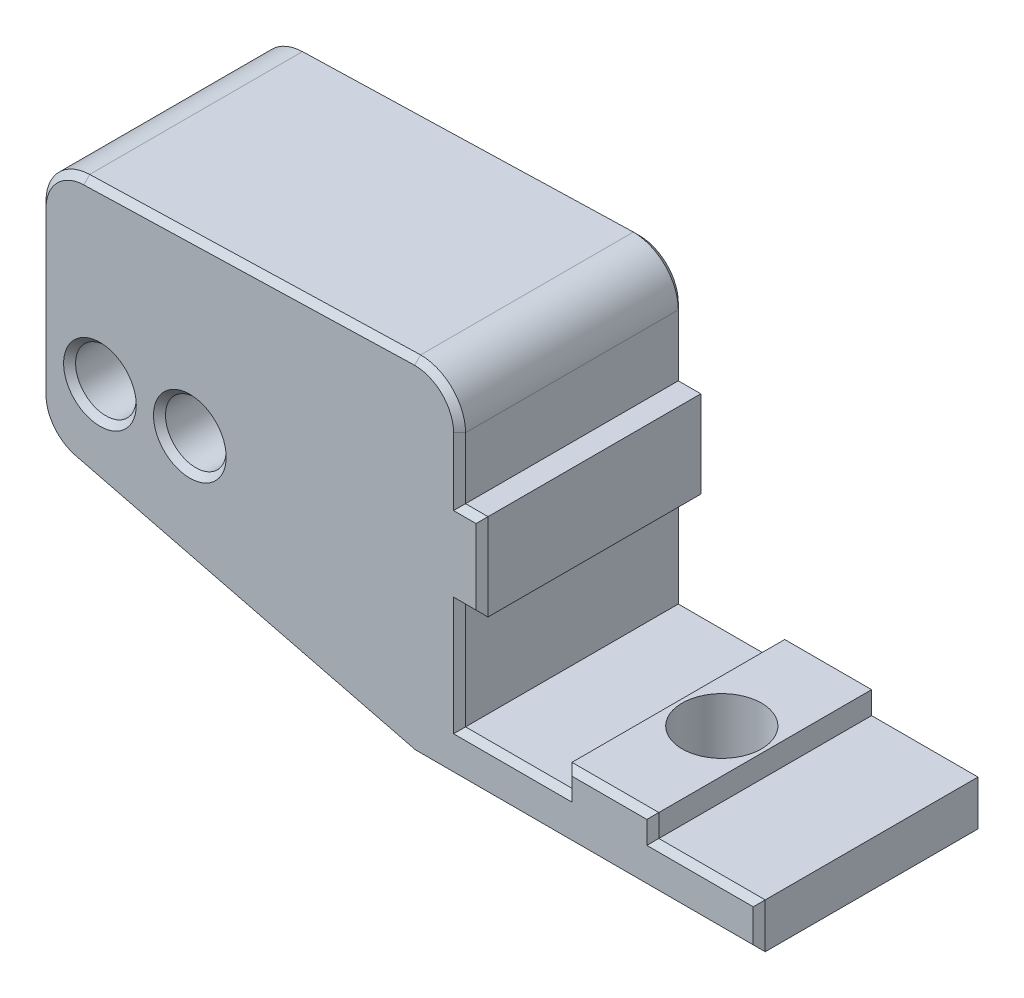
from build123d import *

# Parameters (mm, degrees)
SKETCH1_R           = 3.025
SKETCH1_R_2         = 2.025
BOSS_EXTRUDE1_DEPTH = 15
BOSS_EXTRUDE2_START = 6
SKETCH1_2_R         = 3.025
BOSS_EXTRUDE2_DEPTH = 9
SKETCH2_R           = 2.65
CUT_EXTRUDE1_DEPTH  = 70
FILLET1_R           = 3
CHAMFER1_SIZE       = 0.4


# Some blends are built 0.0001 mm under size
with BuildPart() as part:
    # Sketch1 → Boss-Extrude1 (new body)
    with BuildSketch(Plane.XY):
        Polygon((66.489922843, -72.31585339), (69.489922843, -72.31585339), (69.489922843, -79.41585339), (70.989922843, -79.41585339), (70.989922843, -85.21585339), (69.489922843, -85.21585339), (69.489922843, -92.31585339), (76.589922843, -92.31585339), (76.589922843, -90.81585339), (82.389922843, -90.81585339), (82.389922843, -92.31585339), (89.489922843, -92.31585339), (89.489922843, -95.31585339), (66.489922843, -95.31585339), (41.489922843, -89.06585339), (41.489922843, -73.010297834), align=None)
        with Locations((48.489922843, -77.31585339)):
            Circle(SKETCH1_R, mode=Mode.SUBTRACT)
        with Locations((45.489922843, -84.31585339)):
            Circle(SKETCH1_R_2, mode=Mode.SUBTRACT)
        with Locations((51.489922843, -84.31585339)):
            Circle(SKETCH1_R_2, mode=Mode.SUBTRACT)
    extrude(amount=BOSS_EXTRUDE1_DEPTH)

    # Sketch1<2> → Boss-Extrude2 (add)
    with BuildSketch(Plane.XY.offset(BOSS_EXTRUDE2_START)):
        with Locations((48.489922843, -77.31585339)):
            Circle(SKETCH1_2_R)
    extrude(amount=BOSS_EXTRUDE2_DEPTH)

    # Sketch2 → Cut-Extrude1 (cut)
    with BuildSketch(Plane.XZ.offset(95.31585339)):
        with Locations(Location((79.489922843, 7.5, 0), (0, 0, 270))):
            Circle(SKETCH2_R)
    extrude(amount=-CUT_EXTRUDE1_DEPTH, mode=Mode.SUBTRACT)

    # Fillet1
    fillet1_edges = [part.edges().sort_by_distance(p)[0] for p in [
        (69.489922843, -72.31585339, 7.5),
        (41.489922843, -73.010297834, 7.5),
        (41.489922843, -89.06585339, 7.5),
    ]]
    fillet(fillet1_edges, radius=FILLET1_R - 0.0001)  # a hair under: the kernel refuses the full size

    # Chamfer1
    # the kernel refuses this chamfer: 0.4 mm, written as the material it takes off along each edge
    with BuildSketch(Plane(origin=(69.489922843, -75.31575339, 0), x_dir=(-0.9996219169112966, 2.140826135148345e-13, -0.027495876610585536), z_dir=(0, -1, 0))) as chamfer1_piece_1:
        Polygon((CHAMFER1_SIZE * 0.999621916911, -CHAMFER1_SIZE * 0.0274958766106), (-CHAMFER1_SIZE * 0.0274958766106, -CHAMFER1_SIZE * 0.999621916911), (0, 0), align=None)
    extrude(amount=4.1001, mode=Mode.SUBTRACT)
    with BuildSketch(Plane(origin=(69.489922843, -79.41585339, 0), x_dir=(0, -0.9996219169112966, -0.027495876610585536), z_dir=(1, 0, 0)), Plane(origin=(72.018596038, -85.21585339, 0), x_dir=(0, 0.9996219169112966, -0.027495876610585536), z_dir=(-1, 0, 0)), Plane(origin=(76.589922843, -92.31585339, 0), x_dir=(0.9996219169112966, 0, -0.027495876610585536), z_dir=(0, 1, 0)), Plane(origin=(82.389922843, -89.787180195, 0), x_dir=(-0.9996219169112966, 0, -0.027495876610585536), z_dir=(0, -1, 0))) as chamfer1_piece_2:
        Polygon((CHAMFER1_SIZE * 0.999621916911, -CHAMFER1_SIZE * 0.0274958766106), (-CHAMFER1_SIZE * 0.0274958766106, -CHAMFER1_SIZE * 0.999621916911), (0, 0), align=None)
    extrude(amount=2.528673195, mode=Mode.SUBTRACT)
    with BuildSketch(Plane(origin=(90.518596038, -95.31585339, 15), x_dir=(0, 0.9996219169112966, 0.02749587661058671), z_dir=(-1, 0, 0))) as chamfer1_piece_3:
        Polygon((CHAMFER1_SIZE * 0.999621916911, CHAMFER1_SIZE * 0.0274958766106), (-CHAMFER1_SIZE * 0.0274958766106, CHAMFER1_SIZE * 0.999621916911), (0, 0), align=None)
    extrude(amount=25.05734639, mode=Mode.SUBTRACT)
    with BuildSketch(Plane(origin=(70.989922843, -78.387180195, 0), x_dir=(-0.9996219169112966, -2.6206664757850423e-13, -0.027495876610585536), z_dir=(0, -1, 0)), Plane(origin=(75.561249648, -90.81585339, 0), x_dir=(0, -0.9996219169112966, -0.027495876610585536), z_dir=(1, 0, 0))) as chamfer1_piece_4:
        Polygon((CHAMFER1_SIZE * 0.999621916911, -CHAMFER1_SIZE * 0.0274958766106), (-CHAMFER1_SIZE * 0.0274958766106, -CHAMFER1_SIZE * 0.999621916911), (0, 0), align=None)
    extrude(amount=7.85734639, mode=Mode.SUBTRACT)
    with BuildSketch(Plane(origin=(69.489922843, -85.21585339, 0), x_dir=(-0.9996219169112966, -2.1408261351483406e-13, -0.027495876610585536), z_dir=(0, -1, 0)), Plane(origin=(69.489922843, -92.31585339, 0), x_dir=(0, -0.9996219169112966, -0.027495876610585536), z_dir=(1, 0, 0))) as chamfer1_piece_5:
        Polygon((CHAMFER1_SIZE * 0.999621916911, -CHAMFER1_SIZE * 0.0274958766106), (-CHAMFER1_SIZE * 0.0274958766106, -CHAMFER1_SIZE * 0.999621916911), (0, 0), align=None)
    extrude(amount=7.1, mode=Mode.SUBTRACT)
    with BuildSketch(Plane(origin=(82.389922843, -92.31585339, 0), x_dir=(0, -0.9996219169112966, -0.027495876610585536), z_dir=(1, 0, 0))) as chamfer1_piece_6:
        Polygon((CHAMFER1_SIZE * 0.999621916911, -CHAMFER1_SIZE * 0.0274958766106), (-CHAMFER1_SIZE * 0.0274958766106, -CHAMFER1_SIZE * 0.999621916911), (0, 0), align=None)
    extrude(amount=8.128673195, mode=Mode.SUBTRACT)
    with BuildSketch(Plane(origin=(89.489922843, -91.287180195, 0), x_dir=(-0.9996219169112966, 0, -0.027495876610585536), z_dir=(0, -1, 0))) as chamfer1_piece_7:
        Polygon((CHAMFER1_SIZE * 0.999621916911, -CHAMFER1_SIZE * 0.0274958766106), (-CHAMFER1_SIZE * 0.0274958766106, -CHAMFER1_SIZE * 0.999621916911), (0, 0), align=None)
    extrude(amount=5.05734639, mode=Mode.SUBTRACT)
    with BuildSketch(Plane(origin=(90.518596038, -95.31585339, 0), x_dir=(0, 0.9996219169112966, -0.027495876610585536), z_dir=(-1, 0, 0))) as chamfer1_piece_8:
        Polygon((CHAMFER1_SIZE * 0.999621916911, -CHAMFER1_SIZE * 0.0274958766106), (-CHAMFER1_SIZE * 0.0274958766106, -CHAMFER1_SIZE * 0.999621916911), (0, 0), align=None)
    extrude(amount=25.05734639, mode=Mode.SUBTRACT)
    with BuildSketch(Plane(origin=(89.489922843, -91.287180195, 15), x_dir=(-0.9996219169112966, 0, 0.02749587661058671), z_dir=(0, -1, 0))) as chamfer1_piece_9:
        Polygon((CHAMFER1_SIZE * 0.999621916911, CHAMFER1_SIZE * 0.0274958766106), (-CHAMFER1_SIZE * 0.0274958766106, CHAMFER1_SIZE * 0.999621916911), (0, 0), align=None)
    extrude(amount=5.05734639, mode=Mode.SUBTRACT)
    with BuildSketch(Plane(origin=(44.406524418, -72.929281124, 0), x_dir=(0.02775656898180667, -0.9992364833450456, -0.027495876610586712), z_dir=(0.9996144206527183, 0.027767067240353136, 0)), Plane(origin=(44.406524418, -72.929281124, 15), x_dir=(-0.0007634798546782339, 0.027485274768416574, -0.9996219169112971), z_dir=(0.9996144206527183, 0.027767067240353136, 0))) as chamfer1_piece_10:
        Polygon((CHAMFER1_SIZE * 0.999621916911, -CHAMFER1_SIZE * 0.0274958766106), (-CHAMFER1_SIZE * 0.0274958766106, -CHAMFER1_SIZE * 0.999621916911), (0, 0), align=None)
    extrude(amount=23.120589807, mode=Mode.SUBTRACT)
    with BuildSketch(Plane(origin=(82.389922843, -92.31585339, 15), x_dir=(0, -0.9996219169112966, 0.02749587661058671), z_dir=(1, 0, 0))) as chamfer1_piece_11:
        Polygon((CHAMFER1_SIZE * 0.999621916911, CHAMFER1_SIZE * 0.0274958766106), (-CHAMFER1_SIZE * 0.0274958766106, CHAMFER1_SIZE * 0.999621916911), (0, 0), align=None)
    extrude(amount=8.128673195, mode=Mode.SUBTRACT)
    with BuildSketch(Plane(origin=(82.389922843, -89.787180195, 15), x_dir=(-0.9996219169112966, 0, 0.02749587661058671), z_dir=(0, -1, 0)), Plane(origin=(76.589922843, -92.31585339, 15), x_dir=(0.9996219169112966, 0, 0.02749587661058671), z_dir=(0, 1, 0)), Plane(origin=(72.018596038, -85.21585339, 15), x_dir=(0, 0.9996219169112966, 0.02749587661058671), z_dir=(-1, 0, 0)), Plane(origin=(69.489922843, -79.41585339, 15), x_dir=(0, -0.9996219169112966, 0.02749587661058671), z_dir=(1, 0, 0))) as chamfer1_piece_12:
        Polygon((CHAMFER1_SIZE * 0.999621916911, CHAMFER1_SIZE * 0.0274958766106), (-CHAMFER1_SIZE * 0.0274958766106, CHAMFER1_SIZE * 0.999621916911), (0, 0), align=None)
    extrude(amount=2.528673195, mode=Mode.SUBTRACT)
    with BuildSketch(Plane(origin=(75.561249648, -90.81585339, 15), x_dir=(0, -0.9996219169112966, 0.02749587661058671), z_dir=(1, 0, 0)), Plane(origin=(70.989922843, -78.387180195, 15), x_dir=(-0.9996219169112966, -2.6206664757850423e-13, 0.02749587661058671), z_dir=(0, -1, 0))) as chamfer1_piece_13:
        Polygon((CHAMFER1_SIZE * 0.999621916911, CHAMFER1_SIZE * 0.0274958766106), (-CHAMFER1_SIZE * 0.0274958766106, CHAMFER1_SIZE * 0.999621916911), (0, 0), align=None)
    extrude(amount=7.85734639, mode=Mode.SUBTRACT)
    with BuildSketch(Plane(origin=(48.489922843, -77.31585339, 0), x_dir=(1, 0, 0), z_dir=(0, -1, 0))) as chamfer1_piece_14:
        Polygon((3.025 + CHAMFER1_SIZE, 0), (3.025, CHAMFER1_SIZE), (3.025, 0), align=None)
    revolve(axis=Axis((48.489922843, -77.31585339, 0), (0, 0, 1)), mode=Mode.SUBTRACT)
    with BuildSketch(Plane(origin=(69.489922843, -92.31585339, 15), x_dir=(0, -0.9996219169112966, 0.02749587661058671), z_dir=(1, 0, 0)), Plane(origin=(69.489922843, -85.21585339, 15), x_dir=(-0.9996219169112966, -2.1408261351483406e-13, 0.02749587661058671), z_dir=(0, -1, 0))) as chamfer1_piece_15:
        Polygon((CHAMFER1_SIZE * 0.999621916911, CHAMFER1_SIZE * 0.0274958766106), (-CHAMFER1_SIZE * 0.0274958766106, CHAMFER1_SIZE * 0.999621916911), (0, 0), align=None)
    extrude(amount=7.1, mode=Mode.SUBTRACT)
    with BuildSketch(Plane(origin=(45.489922843, -84.31585339, 0), x_dir=(1, 0, 0), z_dir=(0, -1, 0))) as chamfer1_piece_16:
        Polygon((2.025 + CHAMFER1_SIZE, 0), (2.025, CHAMFER1_SIZE), (2.025, 0), align=None)
    revolve(axis=Axis((45.489922843, -84.31585339, 0), (0, 0, 1)), mode=Mode.SUBTRACT)
    with BuildSketch(Plane(origin=(45.489922843, -84.31585339, 15), x_dir=(1, 0, 0), z_dir=(0, -1, 0))) as chamfer1_piece_17:
        Polygon((2.025 + CHAMFER1_SIZE, 0), (2.025, -CHAMFER1_SIZE), (2.025, 0), align=None)
    revolve(axis=Axis((45.489922843, -84.31585339, 15), (0, 0, 1)), mode=Mode.SUBTRACT)
    with BuildSketch(Plane(origin=(51.489922843, -84.31585339, 0), x_dir=(1, 0, 0), z_dir=(0, -1, 0))) as chamfer1_piece_18:
        Polygon((2.025 + CHAMFER1_SIZE, 0), (2.025, CHAMFER1_SIZE), (2.025, 0), align=None)
    revolve(axis=Axis((51.489922843, -84.31585339, 0), (0, 0, 1)), mode=Mode.SUBTRACT)
    with BuildSketch(Plane(origin=(51.489922843, -84.31585339, 15), x_dir=(1, 0, 0), z_dir=(0, -1, 0))) as chamfer1_piece_19:
        Polygon((2.025 + CHAMFER1_SIZE, 0), (2.025, -CHAMFER1_SIZE), (2.025, 0), align=None)
    revolve(axis=Axis((51.489922843, -84.31585339, 15), (0, 0, 1)), mode=Mode.SUBTRACT)
    with BuildSketch(Plane(origin=(69.489922843, -75.31575339, 15), x_dir=(-0.9996219169112966, 2.140826135148345e-13, 0.02749587661058671), z_dir=(0, -1, 0))) as chamfer1_piece_20:
        Polygon((CHAMFER1_SIZE * 0.999621916911, CHAMFER1_SIZE * 0.0274958766106), (-CHAMFER1_SIZE * 0.0274958766106, CHAMFER1_SIZE * 0.999621916911), (0, 0), align=None)
    extrude(amount=4.1001, mode=Mode.SUBTRACT)
    with BuildSketch(Plane(origin=(67.487882428, -95.565343286, 0), x_dir=(0.2424439264180973, 0.969775705672395, -0.02749587661058577), z_dir=(-0.9701425001453322, 0.2425356250363316, 0))) as chamfer1_piece_21:
        Polygon((CHAMFER1_SIZE * 0.999621916911, -CHAMFER1_SIZE * 0.0274958766106), (-CHAMFER1_SIZE * 0.0274958766106, -CHAMFER1_SIZE * 0.999621916911), (0, 0), align=None)
    extrude(amount=24.455832214, mode=Mode.SUBTRACT)
    with BuildSketch(Plane(origin=(41.489922843, -86.723602248, 0), x_dir=(0.9996219169112968, 0, -0.02749587661058673), z_dir=(0, 1, 0))) as chamfer1_piece_22:
        Polygon((CHAMFER1_SIZE * 0.999621916911, -CHAMFER1_SIZE * 0.0274958766106), (-CHAMFER1_SIZE * 0.0274958766106, -CHAMFER1_SIZE * 0.999621916911), (0, 0), align=None)
    extrude(amount=10.795577824, mode=Mode.SUBTRACT)
    with BuildSketch(Plane(origin=(44.489822843, -86.723602248, 0), x_dir=(-1, 0, 0), z_dir=(0, 1, 0))) as chamfer1_piece_23:
        Polygon((2.9999 - CHAMFER1_SIZE, 0), (2.9999, CHAMFER1_SIZE), (2.9999, 0), align=None)
    revolve(axis=Axis((44.489822843, -86.723602248, 0), (0, 0, 1)), revolution_arc=75.963756532, mode=Mode.SUBTRACT)
    with BuildSketch(Plane(origin=(44.489822843, -75.928024424, 0), x_dir=(-0.02776706724035276, 0.9996144206527183, 0), z_dir=(0.9996144206527183, 0.02776706724035276, 0))) as chamfer1_piece_24:
        Polygon((2.9999 - CHAMFER1_SIZE, 0), (2.9999, CHAMFER1_SIZE), (2.9999, 0), align=None)
    revolve(axis=Axis((44.489822843, -75.928024424, 0), (0, 0, 1)), revolution_arc=88.408859729, mode=Mode.SUBTRACT)
    with BuildSketch(Plane(origin=(66.490022843, -75.31575339, 0), x_dir=(0, 1, 0), z_dir=(-1, 0, 0))) as chamfer1_piece_25:
        Polygon((2.9999 - CHAMFER1_SIZE, 0), (2.9999, -CHAMFER1_SIZE), (2.9999, 0), align=None)
    revolve(axis=Axis((66.490022843, -75.31575339, 0), (0, 0, -1)), revolution_arc=90, mode=Mode.SUBTRACT)
    with BuildSketch(Plane(origin=(41.489922843, -86.723602248, 15), x_dir=(0.9996219169112966, 0, 0.027495876610587656), z_dir=(0, 1, 0))) as chamfer1_piece_26:
        Polygon((CHAMFER1_SIZE * 0.999621916911, CHAMFER1_SIZE * 0.0274958766106), (-CHAMFER1_SIZE * 0.0274958766106, CHAMFER1_SIZE * 0.999621916911), (0, 0), align=None)
    extrude(amount=10.795577824, mode=Mode.SUBTRACT)
    with BuildSketch(Plane(origin=(67.487882428, -95.565343286, 15), x_dir=(0.24244392641809726, 0.9697757056723949, 0.027495876610587038), z_dir=(-0.9701425001453322, 0.2425356250363316, 0))) as chamfer1_piece_27:
        Polygon((CHAMFER1_SIZE * 0.999621916911, CHAMFER1_SIZE * 0.0274958766106), (-CHAMFER1_SIZE * 0.0274958766106, CHAMFER1_SIZE * 0.999621916911), (0, 0), align=None)
    extrude(amount=24.455832214, mode=Mode.SUBTRACT)
    with BuildSketch(Plane(origin=(44.489822843, -86.723602248, 15), x_dir=(-1, 0, 0), z_dir=(0, 1, 0))) as chamfer1_piece_28:
        Polygon((2.9999 - CHAMFER1_SIZE, 0), (2.9999, -CHAMFER1_SIZE), (2.9999, 0), align=None)
    revolve(axis=Axis((44.489822843, -86.723602248, 15), (0, 0, 1)), revolution_arc=75.963756532, mode=Mode.SUBTRACT)
    with BuildSketch(Plane(origin=(44.489822843, -75.928024424, 15), x_dir=(-0.02776706724035276, 0.9996144206527183, 0), z_dir=(0.9996144206527183, 0.02776706724035276, 0))) as chamfer1_piece_29:
        Polygon((2.9999 - CHAMFER1_SIZE, 0), (2.9999, -CHAMFER1_SIZE), (2.9999, 0), align=None)
    revolve(axis=Axis((44.489822843, -75.928024424, 15), (0, 0, 1)), revolution_arc=88.408859729, mode=Mode.SUBTRACT)
    with BuildSketch(Plane(origin=(66.490022843, -75.31575339, 15), x_dir=(0, 1, 0), z_dir=(-1, 0, 0))) as chamfer1_piece_30:
        Polygon((2.9999, CHAMFER1_SIZE), (2.9999 - CHAMFER1_SIZE, 0), (2.9999, 0), align=None)
    revolve(axis=Axis((66.490022843, -75.31575339, 15), (0, 0, -1)), revolution_arc=90, mode=Mode.SUBTRACT)
    with BuildSketch(Plane(origin=(65.461249648, -72.31585339, 15), x_dir=(0, 0.027495876610595927, -0.9996219169112964), z_dir=(1, 0, 0))) as chamfer1_piece_31:
        Polygon((CHAMFER1_SIZE * 0.999621916911, -CHAMFER1_SIZE * 0.0274958766106), (-CHAMFER1_SIZE * 0.0274958766106, -CHAMFER1_SIZE * 0.999621916911), (0, 0), align=None)
    extrude(amount=1.028773195, mode=Mode.SUBTRACT)
    with BuildSketch(Plane(origin=(65.461249648, -72.31585339, 0), x_dir=(0, 0.027495876610595986, 0.9996219169112965), z_dir=(1, 0, 0))) as chamfer1_piece_32:
        Polygon((CHAMFER1_SIZE * 0.999621916911, CHAMFER1_SIZE * 0.0274958766106), (-CHAMFER1_SIZE * 0.0274958766106, CHAMFER1_SIZE * 0.999621916911), (0, 0), align=None)
    extrude(amount=1.028773195, mode=Mode.SUBTRACT)
    with BuildSketch(Plane(origin=(69.489922843, -75.31575339, 0), x_dir=(-0.9996219169112966, 2.140826135148345e-13, -0.027495876610585536), z_dir=(0, -1, 0))) as chamfer1_piece_33a_section:
        Polygon((CHAMFER1_SIZE * 0.999621916911, -CHAMFER1_SIZE * 0.0274958766106), (-CHAMFER1_SIZE * 0.0274958766106, -CHAMFER1_SIZE * 0.999621916911), (0, 0), align=None)
    chamfer1_piece_33a = extrude(amount=5.128773195, mode=Mode.PRIVATE)
    chamfer1_piece_33a = split(chamfer1_piece_33a, bisect_by=Plane(origin=(69.358005392, -79.41585339, 0.131917451), z_dir=(0, -1, 0)), keep=Keep.TOP, mode=Mode.PRIVATE)
    with BuildSketch(Plane(origin=(68.461249648, -79.41585339, 0), x_dir=(0, -0.9996219169112966, -0.027495876610585536), z_dir=(1, 0, 0))) as chamfer1_piece_33b_section:
        Polygon((CHAMFER1_SIZE * 0.999621916911, -CHAMFER1_SIZE * 0.0274958766106), (-CHAMFER1_SIZE * 0.0274958766106, -CHAMFER1_SIZE * 0.999621916911), (0, 0), align=None)
    chamfer1_piece_33b = extrude(amount=3.55734639, mode=Mode.PRIVATE)
    chamfer1_piece_33b = split(chamfer1_piece_33b, bisect_by=Plane(origin=(69.489922843, -79.54777084, 0.131917451), z_dir=(-1, 0, 0)), keep=Keep.TOP, mode=Mode.PRIVATE)
    chamfer1_piece_33 = chamfer1_piece_33a & chamfer1_piece_33b
    add(chamfer1_piece_33, mode=Mode.SUBTRACT)
    with BuildSketch(Plane(origin=(72.018596038, -85.21585339, 0), x_dir=(0, 0.9996219169112966, -0.027495876610585536), z_dir=(-1, 0, 0))) as chamfer1_piece_34a_section:
        Polygon((CHAMFER1_SIZE * 0.999621916911, -CHAMFER1_SIZE * 0.0274958766106), (-CHAMFER1_SIZE * 0.0274958766106, -CHAMFER1_SIZE * 0.999621916911), (0, 0), align=None)
    chamfer1_piece_34a = extrude(amount=3.55734639, mode=Mode.PRIVATE)
    chamfer1_piece_34a = split(chamfer1_piece_34a, bisect_by=Plane(origin=(69.489922843, -85.083935939, 0.131917451), z_dir=(-1, 0, 0)), keep=Keep.TOP, mode=Mode.PRIVATE)
    with BuildSketch(Plane(origin=(69.489922843, -84.187180195, 0), x_dir=(-0.9996219169112966, -2.1408261351483406e-13, -0.027495876610585536), z_dir=(0, -1, 0))) as chamfer1_piece_34b_section:
        Polygon((CHAMFER1_SIZE * 0.999621916911, -CHAMFER1_SIZE * 0.0274958766106), (-CHAMFER1_SIZE * 0.0274958766106, -CHAMFER1_SIZE * 0.999621916911), (0, 0), align=None)
    chamfer1_piece_34b = extrude(amount=8.128673195, mode=Mode.PRIVATE)
    chamfer1_piece_34b = split(chamfer1_piece_34b, bisect_by=Plane(origin=(69.358005392, -85.21585339, 0.131917451), z_dir=(0, 1, 0)), keep=Keep.TOP, mode=Mode.PRIVATE)
    chamfer1_piece_34 = chamfer1_piece_34a & chamfer1_piece_34b
    add(chamfer1_piece_34, mode=Mode.SUBTRACT)
    with BuildSketch(Plane(origin=(69.489922843, -85.21585339, 0), x_dir=(-0.9996219169112966, -2.1408261351483406e-13, -0.027495876610585536), z_dir=(0, -1, 0))) as chamfer1_piece_35a_section:
        Polygon((CHAMFER1_SIZE * 0.999621916911, -CHAMFER1_SIZE * 0.0274958766106), (-CHAMFER1_SIZE * 0.0274958766106, -CHAMFER1_SIZE * 0.999621916911), (0, 0), align=None)
    chamfer1_piece_35a = extrude(amount=8.128673195, mode=Mode.PRIVATE)
    chamfer1_piece_35a = split(chamfer1_piece_35a, bisect_by=Plane(origin=(69.358005392, -92.31585339, 0.131917451), z_dir=(0, -1, 0)), keep=Keep.TOP, mode=Mode.PRIVATE)
    with BuildSketch(Plane(origin=(68.461249648, -92.31585339, 0), x_dir=(0, -0.9996219169112966, -0.027495876610585536), z_dir=(1, 0, 0))) as chamfer1_piece_35b_section:
        Polygon((CHAMFER1_SIZE * 0.999621916911, -CHAMFER1_SIZE * 0.0274958766106), (-CHAMFER1_SIZE * 0.0274958766106, -CHAMFER1_SIZE * 0.999621916911), (0, 0), align=None)
    chamfer1_piece_35b = extrude(amount=8.128673195, mode=Mode.PRIVATE)
    chamfer1_piece_35b = split(chamfer1_piece_35b, bisect_by=Plane(origin=(69.489922843, -92.44777084, 0.131917451), z_dir=(-1, 0, 0)), keep=Keep.TOP, mode=Mode.PRIVATE)
    chamfer1_piece_35 = chamfer1_piece_35a & chamfer1_piece_35b
    add(chamfer1_piece_35, mode=Mode.SUBTRACT)
    with BuildSketch(Plane(origin=(69.489922843, -92.31585339, 0), x_dir=(0, -0.9996219169112966, -0.027495876610585536), z_dir=(1, 0, 0))) as chamfer1_piece_36a_section:
        Polygon((CHAMFER1_SIZE * 0.999621916911, -CHAMFER1_SIZE * 0.0274958766106), (-CHAMFER1_SIZE * 0.0274958766106, -CHAMFER1_SIZE * 0.999621916911), (0, 0), align=None)
    chamfer1_piece_36a = extrude(amount=8.128673195, mode=Mode.PRIVATE)
    chamfer1_piece_36a = split(chamfer1_piece_36a, bisect_by=Plane(origin=(76.589922843, -92.44777084, 0.131917451), z_dir=(1, 0, 0)), keep=Keep.TOP, mode=Mode.PRIVATE)
    with BuildSketch(Plane(origin=(76.589922843, -93.344526585, 0), x_dir=(0.9996219169112966, 0, -0.027495876610585536), z_dir=(0, 1, 0))) as chamfer1_piece_36b_section:
        Polygon((CHAMFER1_SIZE * 0.999621916911, -CHAMFER1_SIZE * 0.0274958766106), (-CHAMFER1_SIZE * 0.0274958766106, -CHAMFER1_SIZE * 0.999621916911), (0, 0), align=None)
    chamfer1_piece_36b = extrude(amount=3.55734639, mode=Mode.PRIVATE)
    chamfer1_piece_36b = split(chamfer1_piece_36b, bisect_by=Plane(origin=(76.721840294, -92.31585339, 0.131917451), z_dir=(0, -1, 0)), keep=Keep.TOP, mode=Mode.PRIVATE)
    chamfer1_piece_36 = chamfer1_piece_36a & chamfer1_piece_36b
    add(chamfer1_piece_36, mode=Mode.SUBTRACT)
    with BuildSketch(Plane(origin=(81.361249648, -92.31585339, 0), x_dir=(0, -0.9996219169112966, -0.027495876610585536), z_dir=(1, 0, 0))) as chamfer1_piece_37a_section:
        Polygon((CHAMFER1_SIZE * 0.999621916911, -CHAMFER1_SIZE * 0.0274958766106), (-CHAMFER1_SIZE * 0.0274958766106, -CHAMFER1_SIZE * 0.999621916911), (0, 0), align=None)
    chamfer1_piece_37a = extrude(amount=9.15734639, mode=Mode.PRIVATE)
    chamfer1_piece_37a = split(chamfer1_piece_37a, bisect_by=Plane(origin=(82.389922843, -92.44777084, 0.131917451), z_dir=(-1, 0, 0)), keep=Keep.TOP, mode=Mode.PRIVATE)
    with BuildSketch(Plane(origin=(82.389922843, -89.787180195, 0), x_dir=(-0.9996219169112966, 0, -0.027495876610585536), z_dir=(0, -1, 0))) as chamfer1_piece_37b_section:
        Polygon((CHAMFER1_SIZE * 0.999621916911, -CHAMFER1_SIZE * 0.0274958766106), (-CHAMFER1_SIZE * 0.0274958766106, -CHAMFER1_SIZE * 0.999621916911), (0, 0), align=None)
    chamfer1_piece_37b = extrude(amount=3.55734639, mode=Mode.PRIVATE)
    chamfer1_piece_37b = split(chamfer1_piece_37b, bisect_by=Plane(origin=(82.258005392, -92.31585339, 0.131917451), z_dir=(0, -1, 0)), keep=Keep.TOP, mode=Mode.PRIVATE)
    chamfer1_piece_37 = chamfer1_piece_37a & chamfer1_piece_37b
    add(chamfer1_piece_37, mode=Mode.SUBTRACT)
    with BuildSketch(Plane(origin=(81.361249648, -92.31585339, 15), x_dir=(0, -0.9996219169112966, 0.02749587661058671), z_dir=(1, 0, 0))) as chamfer1_piece_38a_section:
        Polygon((CHAMFER1_SIZE * 0.999621916911, CHAMFER1_SIZE * 0.0274958766106), (-CHAMFER1_SIZE * 0.0274958766106, CHAMFER1_SIZE * 0.999621916911), (0, 0), align=None)
    chamfer1_piece_38a = extrude(amount=9.15734639, mode=Mode.PRIVATE)
    chamfer1_piece_38a = split(chamfer1_piece_38a, bisect_by=Plane(origin=(82.389922843, -92.44777084, 14.868082549), z_dir=(-1, 0, 0)), keep=Keep.TOP, mode=Mode.PRIVATE)
    with BuildSketch(Plane(origin=(82.389922843, -89.787180195, 15), x_dir=(-0.9996219169112966, 0, 0.02749587661058671), z_dir=(0, -1, 0))) as chamfer1_piece_38b_section:
        Polygon((CHAMFER1_SIZE * 0.999621916911, CHAMFER1_SIZE * 0.0274958766106), (-CHAMFER1_SIZE * 0.0274958766106, CHAMFER1_SIZE * 0.999621916911), (0, 0), align=None)
    chamfer1_piece_38b = extrude(amount=3.55734639, mode=Mode.PRIVATE)
    chamfer1_piece_38b = split(chamfer1_piece_38b, bisect_by=Plane(origin=(82.258005392, -92.31585339, 14.868082549), z_dir=(0, -1, 0)), keep=Keep.TOP, mode=Mode.PRIVATE)
    chamfer1_piece_38 = chamfer1_piece_38a & chamfer1_piece_38b
    add(chamfer1_piece_38, mode=Mode.SUBTRACT)
    with BuildSketch(Plane(origin=(69.489922843, -92.31585339, 15), x_dir=(0, -0.9996219169112966, 0.02749587661058671), z_dir=(1, 0, 0))) as chamfer1_piece_39a_section:
        Polygon((CHAMFER1_SIZE * 0.999621916911, CHAMFER1_SIZE * 0.0274958766106), (-CHAMFER1_SIZE * 0.0274958766106, CHAMFER1_SIZE * 0.999621916911), (0, 0), align=None)
    chamfer1_piece_39a = extrude(amount=8.128673195, mode=Mode.PRIVATE)
    chamfer1_piece_39a = split(chamfer1_piece_39a, bisect_by=Plane(origin=(76.589922843, -92.44777084, 14.868082549), z_dir=(1, 0, 0)), keep=Keep.TOP, mode=Mode.PRIVATE)
    with BuildSketch(Plane(origin=(76.589922843, -93.344526585, 15), x_dir=(0.9996219169112966, 0, 0.02749587661058671), z_dir=(0, 1, 0))) as chamfer1_piece_39b_section:
        Polygon((CHAMFER1_SIZE * 0.999621916911, CHAMFER1_SIZE * 0.0274958766106), (-CHAMFER1_SIZE * 0.0274958766106, CHAMFER1_SIZE * 0.999621916911), (0, 0), align=None)
    chamfer1_piece_39b = extrude(amount=3.55734639, mode=Mode.PRIVATE)
    chamfer1_piece_39b = split(chamfer1_piece_39b, bisect_by=Plane(origin=(76.721840294, -92.31585339, 14.868082549), z_dir=(0, -1, 0)), keep=Keep.TOP, mode=Mode.PRIVATE)
    chamfer1_piece_39 = chamfer1_piece_39a & chamfer1_piece_39b
    add(chamfer1_piece_39, mode=Mode.SUBTRACT)
    with BuildSketch(Plane(origin=(69.489922843, -85.21585339, 15), x_dir=(-0.9996219169112966, -2.1408261351483406e-13, 0.02749587661058671), z_dir=(0, -1, 0))) as chamfer1_piece_40a_section:
        Polygon((CHAMFER1_SIZE * 0.999621916911, CHAMFER1_SIZE * 0.0274958766106), (-CHAMFER1_SIZE * 0.0274958766106, CHAMFER1_SIZE * 0.999621916911), (0, 0), align=None)
    chamfer1_piece_40a = extrude(amount=8.128673195, mode=Mode.PRIVATE)
    chamfer1_piece_40a = split(chamfer1_piece_40a, bisect_by=Plane(origin=(69.358005392, -92.31585339, 14.868082549), z_dir=(0, -1, 0)), keep=Keep.TOP, mode=Mode.PRIVATE)
    with BuildSketch(Plane(origin=(68.461249648, -92.31585339, 15), x_dir=(0, -0.9996219169112966, 0.02749587661058671), z_dir=(1, 0, 0))) as chamfer1_piece_40b_section:
        Polygon((CHAMFER1_SIZE * 0.999621916911, CHAMFER1_SIZE * 0.0274958766106), (-CHAMFER1_SIZE * 0.0274958766106, CHAMFER1_SIZE * 0.999621916911), (0, 0), align=None)
    chamfer1_piece_40b = extrude(amount=8.128673195, mode=Mode.PRIVATE)
    chamfer1_piece_40b = split(chamfer1_piece_40b, bisect_by=Plane(origin=(69.489922843, -92.44777084, 14.868082549), z_dir=(-1, 0, 0)), keep=Keep.TOP, mode=Mode.PRIVATE)
    chamfer1_piece_40 = chamfer1_piece_40a & chamfer1_piece_40b
    add(chamfer1_piece_40, mode=Mode.SUBTRACT)
    with BuildSketch(Plane(origin=(72.018596038, -85.21585339, 15), x_dir=(0, 0.9996219169112966, 0.02749587661058671), z_dir=(-1, 0, 0))) as chamfer1_piece_41a_section:
        Polygon((CHAMFER1_SIZE * 0.999621916911, CHAMFER1_SIZE * 0.0274958766106), (-CHAMFER1_SIZE * 0.0274958766106, CHAMFER1_SIZE * 0.999621916911), (0, 0), align=None)
    chamfer1_piece_41a = extrude(amount=3.55734639, mode=Mode.PRIVATE)
    chamfer1_piece_41a = split(chamfer1_piece_41a, bisect_by=Plane(origin=(69.489922843, -85.083935939, 14.868082549), z_dir=(-1, 0, 0)), keep=Keep.TOP, mode=Mode.PRIVATE)
    with BuildSketch(Plane(origin=(69.489922843, -84.187180195, 15), x_dir=(-0.9996219169112966, -2.1408261351483406e-13, 0.02749587661058671), z_dir=(0, -1, 0))) as chamfer1_piece_41b_section:
        Polygon((CHAMFER1_SIZE * 0.999621916911, CHAMFER1_SIZE * 0.0274958766106), (-CHAMFER1_SIZE * 0.0274958766106, CHAMFER1_SIZE * 0.999621916911), (0, 0), align=None)
    chamfer1_piece_41b = extrude(amount=8.128673195, mode=Mode.PRIVATE)
    chamfer1_piece_41b = split(chamfer1_piece_41b, bisect_by=Plane(origin=(69.358005392, -85.21585339, 14.868082549), z_dir=(0, 1, 0)), keep=Keep.TOP, mode=Mode.PRIVATE)
    chamfer1_piece_41 = chamfer1_piece_41a & chamfer1_piece_41b
    add(chamfer1_piece_41, mode=Mode.SUBTRACT)
    with BuildSketch(Plane(origin=(69.489922843, -75.31575339, 15), x_dir=(-0.9996219169112966, 2.140826135148345e-13, 0.02749587661058671), z_dir=(0, -1, 0))) as chamfer1_piece_42a_section:
        Polygon((CHAMFER1_SIZE * 0.999621916911, CHAMFER1_SIZE * 0.0274958766106), (-CHAMFER1_SIZE * 0.0274958766106, CHAMFER1_SIZE * 0.999621916911), (0, 0), align=None)
    chamfer1_piece_42a = extrude(amount=5.128773195, mode=Mode.PRIVATE)
    chamfer1_piece_42a = split(chamfer1_piece_42a, bisect_by=Plane(origin=(69.358005392, -79.41585339, 14.868082549), z_dir=(0, -1, 0)), keep=Keep.TOP, mode=Mode.PRIVATE)
    with BuildSketch(Plane(origin=(68.461249648, -79.41585339, 15), x_dir=(0, -0.9996219169112966, 0.02749587661058671), z_dir=(1, 0, 0))) as chamfer1_piece_42b_section:
        Polygon((CHAMFER1_SIZE * 0.999621916911, CHAMFER1_SIZE * 0.0274958766106), (-CHAMFER1_SIZE * 0.0274958766106, CHAMFER1_SIZE * 0.999621916911), (0, 0), align=None)
    chamfer1_piece_42b = extrude(amount=3.55734639, mode=Mode.PRIVATE)
    chamfer1_piece_42b = split(chamfer1_piece_42b, bisect_by=Plane(origin=(69.489922843, -79.54777084, 14.868082549), z_dir=(-1, 0, 0)), keep=Keep.TOP, mode=Mode.PRIVATE)
    chamfer1_piece_42 = chamfer1_piece_42a & chamfer1_piece_42b
    add(chamfer1_piece_42, mode=Mode.SUBTRACT)


solid = part.part
